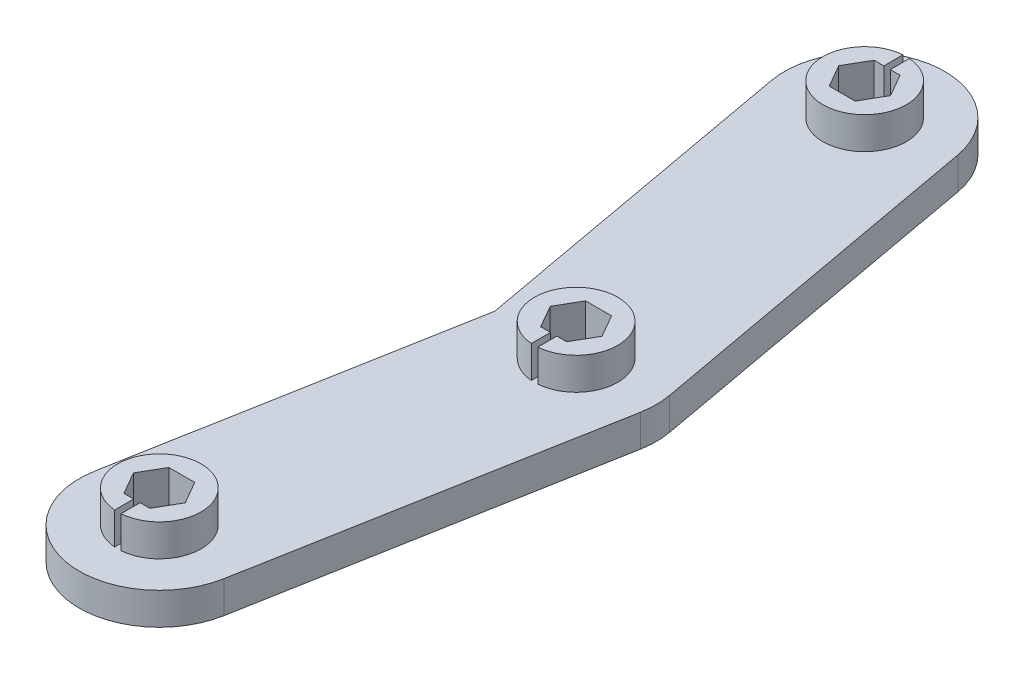
from build123d import *

# Parameters (mm, degrees)
SALIENTE_EXTRUIR1_DEPTH    = 10
CORTAR_EXTRUIR1_DEPTH      = 143.653426177
CORTAR_EXTRUIR1_DEPTH_BACK = 143.653426177
SALIENTE_EXTRUIR2_DEPTH    = 10


with BuildPart() as part:
    # Croquis1 → Saliente-Extruir1 (new body)
    with BuildSketch(Plane(origin=(0, 0, 0), x_dir=(1, 0, 0), z_dir=(0, 1, 0))):
        with BuildLine():
            Line((-44.596747752, 105.527864045), (-25.409863381, 0))
            Line((-25.409863381, 0), (-44.596747752, -105.527864045))
            ThreePointArc((-44.596747752, -105.527864045), (-24.472135955, -134.596747752), (4.596747752, -114.472135955))
            Line((4.596747752, -114.472135955), (24.596747752, -4.472135955))
            ThreePointArc((24.596747752, -4.472135955), (25, 0), (24.596747752, 4.472135955))
            Line((24.596747752, 4.472135955), (4.596747752, 114.472135955))
            ThreePointArc((4.596747752, 114.472135955), (-24.472135955, 134.596747752), (-44.596747752, 105.527864045))
        make_face()
    extrude(amount=SALIENTE_EXTRUIR1_DEPTH)

    # Croquis3 → Cortar-Extruir1 (cut, two sides: drawn at the far end of the back side and taken through both)
    with BuildSketch(Plane(origin=(0, 0, 0), x_dir=(1, 0, 0), z_dir=(0, 1, 0)).offset(-CORTAR_EXTRUIR1_DEPTH_BACK)):
        Polygon((4.041451884, -7), (8.082903769, 0), (4.041451884, 7), (-4.041451884, 7), (-8.082903769, 0), (-4.041451884, -7), align=None)
        Polygon((-15.958548116, 103), (-11.917096231, 110), (-15.958548116, 117), (-24.041451884, 117), (-28.082903769, 110), (-24.041451884, 103), align=None)
        Polygon((-15.958548116, -117), (-11.917096231, -110), (-15.958548116, -103), (-24.041451884, -103), (-28.082903769, -110), (-24.041451884, -117), align=None)
    extrude(amount=CORTAR_EXTRUIR1_DEPTH + CORTAR_EXTRUIR1_DEPTH_BACK, mode=Mode.SUBTRACT)

    # Croquis4 → Saliente-Extruir2 (add)
    with BuildSketch(Plane.XZ.offset(-10)):
        with BuildLine():
            Line((-11.917096231, 110), (-15.958548116, 103))
            Line((-15.958548116, 103), (-24.041451884, 103))
            Line((-24.041451884, 103), (-28.082903769, 110))
            Line((-28.082903769, 110), (-24.041451884, 117))
            Line((-24.041451884, 117), (-21, 117))
            Line((-21, 117), (-21, 122.961481397))
            ThreePointArc((-21, 122.961481397), (-20, 97), (-19, 122.961481397))
            Line((-19, 122.961481397), (-19, 117))
            Line((-19, 117), (-15.958548116, 117))
            Line((-15.958548116, 117), (-11.917096231, 110))
        make_face()
        with BuildLine():
            Line((4.041451884, 7), (8.082903769, 0))
            Line((8.082903769, 0), (4.041451884, -7))
            Line((4.041451884, -7), (-4.041451884, -7))
            Line((-4.041451884, -7), (-8.082903769, 0))
            Line((-8.082903769, 0), (-4.041451884, 7))
            Line((-4.041451884, 7), (-1, 7))
            Line((-1, 7), (-1, 12.961481397))
            ThreePointArc((-1, 12.961481397), (0, -13), (1, 12.961481397))
            Line((1, 12.961481397), (1, 7))
            Line((1, 7), (4.041451884, 7))
        make_face()
        with BuildLine():
            Line((-21, -117), (-21, -122.961481397))
            ThreePointArc((-21, -122.961481397), (-20, -97), (-19, -122.961481397))
            Line((-19, -122.961481397), (-19, -117))
            Line((-19, -117), (-15.958548116, -117))
            Line((-15.958548116, -117), (-11.917096231, -110))
            Line((-11.917096231, -110), (-15.958548116, -103))
            Line((-15.958548116, -103), (-24.041451884, -103))
            Line((-24.041451884, -103), (-28.082903769, -110))
            Line((-28.082903769, -110), (-24.041451884, -117))
            Line((-24.041451884, -117), (-21, -117))
        make_face()
    extrude(amount=-SALIENTE_EXTRUIR2_DEPTH)


solid = part.part
